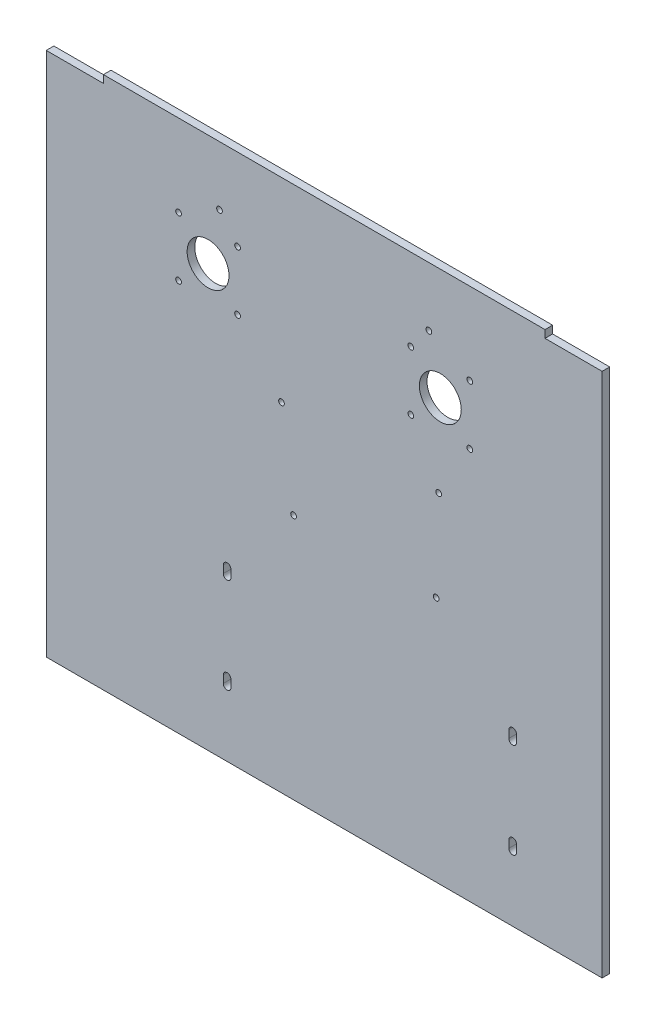
from build123d import *

# Parameters (mm, degrees)
SKETCH1_R           = 1.5
SKETCH1_R_2         = 11
BOSS_EXTRUDE1_DEPTH = 4


with BuildPart() as part:
    # Sketch1 → Boss-Extrude1 (new body)
    with BuildSketch(Plane.XY):
        Polygon((-146, -123.5), (146, -123.5), (146, 152.5), (116, 152.5), (116, 156.5), (-116, 156.5), (-116, 152.5), (-146, 152.5), align=None)
        with BuildLine():
            ThreePointArc((-49, -89), (-51, -91), (-53, -89))
            Line((-53, -89), (-53, -85.07834269))
            ThreePointArc((-53, -85.07834269), (-51, -83.07834269), (-49, -85.07834269))
            Line((-49, -85.07834269), (-49, -89))
        make_face(mode=Mode.SUBTRACT)
        with BuildLine():
            ThreePointArc((-49, -39), (-51, -41), (-53, -39))
            Line((-53, -39), (-53, -35.07834269))
            ThreePointArc((-53, -35.07834269), (-51, -33.07834269), (-49, -35.07834269))
            Line((-49, -35.07834269), (-49, -39))
        make_face(mode=Mode.SUBTRACT)
        with Locations((-16.078681203, 5.935129713)):
            Circle(SKETCH1_R, mode=Mode.SUBTRACT)
        with BuildLine():
            ThreePointArc((101, -89), (99, -91), (97, -89))
            Line((97, -89), (97, -85.07834269))
            ThreePointArc((97, -85.07834269), (99, -83.07834269), (101, -85.07834269))
            Line((101, -85.07834269), (101, -89))
        make_face(mode=Mode.SUBTRACT)
        with Locations((58.851318797, 5.935129713)):
            Circle(SKETCH1_R, mode=Mode.SUBTRACT)
        with BuildLine():
            ThreePointArc((101, -39), (99, -41), (97, -39))
            Line((97, -39), (97, -35.07834269))
            ThreePointArc((97, -35.07834269), (99, -33.07834269), (101, -35.07834269))
            Line((101, -35.07834269), (101, -39))
        make_face(mode=Mode.SUBTRACT)
        with Locations((-76.5, 82.5)):
            Circle(SKETCH1_R, mode=Mode.SUBTRACT)
        with Locations((-45.5, 82.5)):
            Circle(SKETCH1_R, mode=Mode.SUBTRACT)
        with Locations((-22.428681203, 54.195129713)):
            Circle(SKETCH1_R, mode=Mode.SUBTRACT)
        with Locations((-76.5, 113.5)):
            Circle(SKETCH1_R, mode=Mode.SUBTRACT)
        with Locations((-61, 98)):
            Circle(SKETCH1_R_2, mode=Mode.SUBTRACT)
        with Locations((-45.5, 113.5)):
            Circle(SKETCH1_R, mode=Mode.SUBTRACT)
        with Locations((60.121318797, 54.195129713)):
            Circle(SKETCH1_R, mode=Mode.SUBTRACT)
        with Locations((45.5, 82.5)):
            Circle(SKETCH1_R, mode=Mode.SUBTRACT)
        with Locations((76.5, 82.5)):
            Circle(SKETCH1_R, mode=Mode.SUBTRACT)
        with Locations((61, 98)):
            Circle(SKETCH1_R_2, mode=Mode.SUBTRACT)
        with Locations((45.5, 113.5)):
            Circle(SKETCH1_R, mode=Mode.SUBTRACT)
        with Locations((76.5, 113.5)):
            Circle(SKETCH1_R, mode=Mode.SUBTRACT)
        with Locations((55, 125.5)):
            Circle(SKETCH1_R, mode=Mode.SUBTRACT)
        with Locations((-55, 125.5)):
            Circle(SKETCH1_R, mode=Mode.SUBTRACT)
    extrude(amount=BOSS_EXTRUDE1_DEPTH)


solid = part.part
